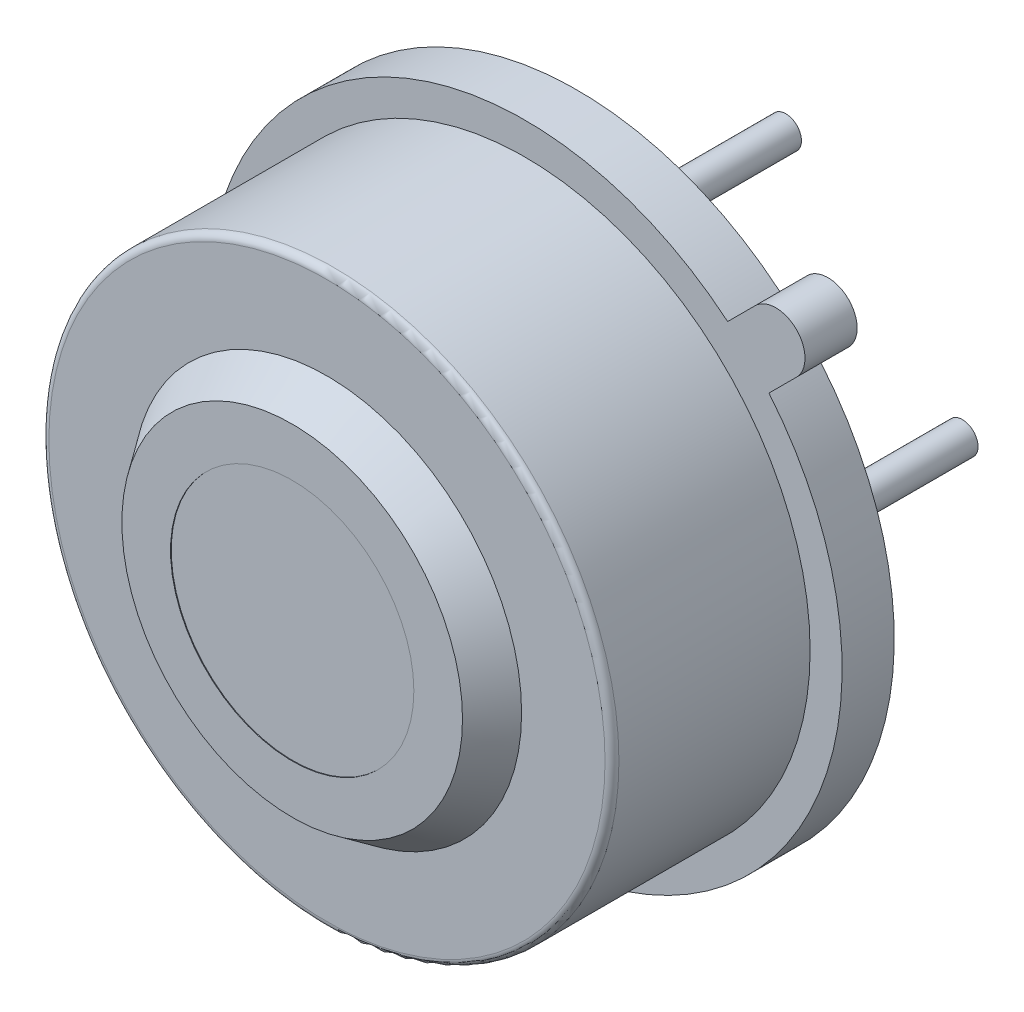
from build123d import *

# Parameters (mm, degrees)
EXTRUDE_1_DEPTH     = 0.75
SKETCH_2_R          = 4.1
EXTRUDE_2_DEPTH     = 2.85
SKETCH_3_R          = 2.8
EXTRUDE_3_DEPTH     = 0.5
SKETCH_4_R          = 1.75
CUT_EXTRUDE_1_DEPTH = 0.01
FILLET_1_R          = 0.1
CHAMFER_1_SIZE2     = 0.350103769
CHAMFER_1_SIZE      = 0.5
SKETCH_5_R          = 0.225
EXTRUDE_4_DEPTH     = 3


with BuildPart() as part:
    # Эскиз1 → Бобышка-Вытянуть1 (new body)
    with BuildSketch(Plane.XY):
        with BuildLine():
            Line((2.91371601, 3.507685706), (3.309259736, 3.903229432))
            ThreePointArc((3.309259736, 3.903229432), (3.903229432, 3.903229432), (3.903229432, 3.309259736))
            Line((3.903229432, 3.309259736), (3.507685706, 2.91371601))
            ThreePointArc((3.507685706, 2.91371601), (-3.224406922, -3.224406922), (2.91371601, 3.507685706))
        make_face()
    extrude(amount=EXTRUDE_1_DEPTH)

    # Эскиз2 → Бобышка-Вытянуть2 (add)
    with BuildSketch(Plane.XY.offset(0.75)):
        Circle(SKETCH_2_R)
    extrude(amount=EXTRUDE_2_DEPTH)

    # Эскиз3 → Бобышка-Вытянуть3 (add)
    with BuildSketch(Plane.XY.offset(3.6)):
        Circle(SKETCH_3_R)
    extrude(amount=EXTRUDE_3_DEPTH)

    # Эскиз4 → Вырез-Вытянуть1 (cut)
    with BuildSketch(Plane.XY.offset(4.1)):
        Circle(SKETCH_4_R)
    extrude(amount=-CUT_EXTRUDE_1_DEPTH, mode=Mode.SUBTRACT)

    # Скругление1
    fillet_1_edges = [part.edges().sort_by_distance(p)[0] for p in [
        (-4.1, 0, 3.6),
    ]]
    fillet(fillet_1_edges, radius=FILLET_1_R)

    # Фаска1
    chamfer_1_edges = [part.edges().sort_by_distance(p)[0] for p in [
        (-2.8, 0, 4.1),
    ]]
    chamfer_1_side = [part.faces().sort_by_distance(p)[0] for p in [
        (-2.8, 0, 4.092997925),
    ]]
    chamfer(chamfer_1_edges, length=CHAMFER_1_SIZE - 0.0001, length2=CHAMFER_1_SIZE2 - 0.0001, reference=chamfer_1_side[0])  # a hair under: the kernel refuses the full size

    # Эскиз5 → Бобышка-Вытянуть4 (add)
    with BuildSketch(Plane(origin=(0, 0, 0), x_dir=(-1, 0, 0), z_dir=(0, 0, -1))):
        with Locations((-2.54, 0)):
            Circle(SKETCH_5_R)
        with Locations((0, -2.54)):
            Circle(SKETCH_5_R)
        with Locations((2.54, 0)):
            Circle(SKETCH_5_R)
        with Locations((0, 2.54)):
            Circle(SKETCH_5_R)
    extrude(amount=EXTRUDE_4_DEPTH)


solid = part.part
